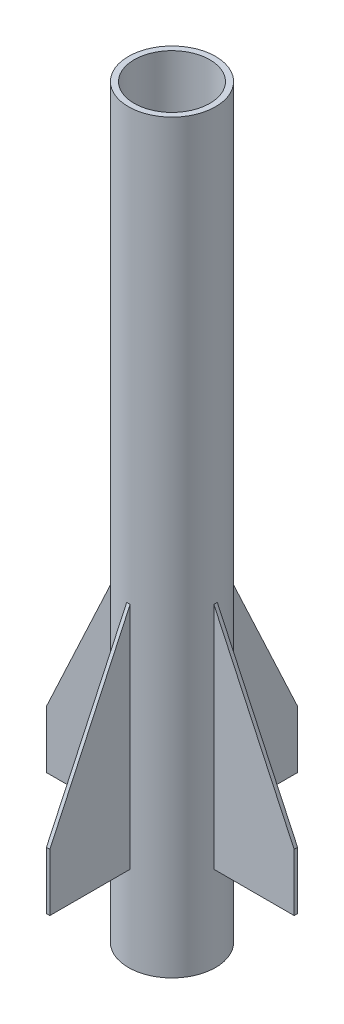
from build123d import *

# Parameters (mm, degrees)
SKETCH1_W                = 10
SKETCH1_H                = 1300
BOSS_EXTRUDE1_DEPTH      = 3
BOSS_EXTRUDE1_DEPTH_BACK = 3
CIRPATTERN2_COUNT        = 4


with BuildPart() as part:
    # Sketch1 → Revolve1 (revolve)
    with BuildSketch(Plane.XY):
        with Locations((71, 650)):
            Rectangle(SKETCH1_W, SKETCH1_H)
    revolve(axis=Axis((0, 0, 0), (0, 1, 0)))


with BuildPart() as body_2:
    # Sketch2 → Boss-Extrude1 (new, two sides: drawn at the far end of the back side and taken through both)
    with BuildSketch(Plane.XY.offset(-BOSS_EXTRUDE1_DEPTH_BACK)):
        Polygon((-76, 550), (-76, 150), (-216, 150), (-216, 250), align=None)
    extrude(amount=BOSS_EXTRUDE1_DEPTH + BOSS_EXTRUDE1_DEPTH_BACK)


with BuildPart() as cirpattern2_1:
    # CirPattern2: pattern copy
    add(body_2.part.rotate(Axis((0, 0, 0), (0, 1, 0)), 1 * 360 / CIRPATTERN2_COUNT))


with BuildPart() as cirpattern2_2:
    # CirPattern2: pattern copy
    add(body_2.part.rotate(Axis((0, 0, 0), (0, 1, 0)), 2 * 360 / CIRPATTERN2_COUNT))


with BuildPart() as cirpattern2_3:
    # CirPattern2: pattern copy
    add(body_2.part.rotate(Axis((0, 0, 0), (0, 1, 0)), 3 * 360 / CIRPATTERN2_COUNT))


solid = Compound([part.part, body_2.part, cirpattern2_1.part, cirpattern2_2.part, cirpattern2_3.part])
